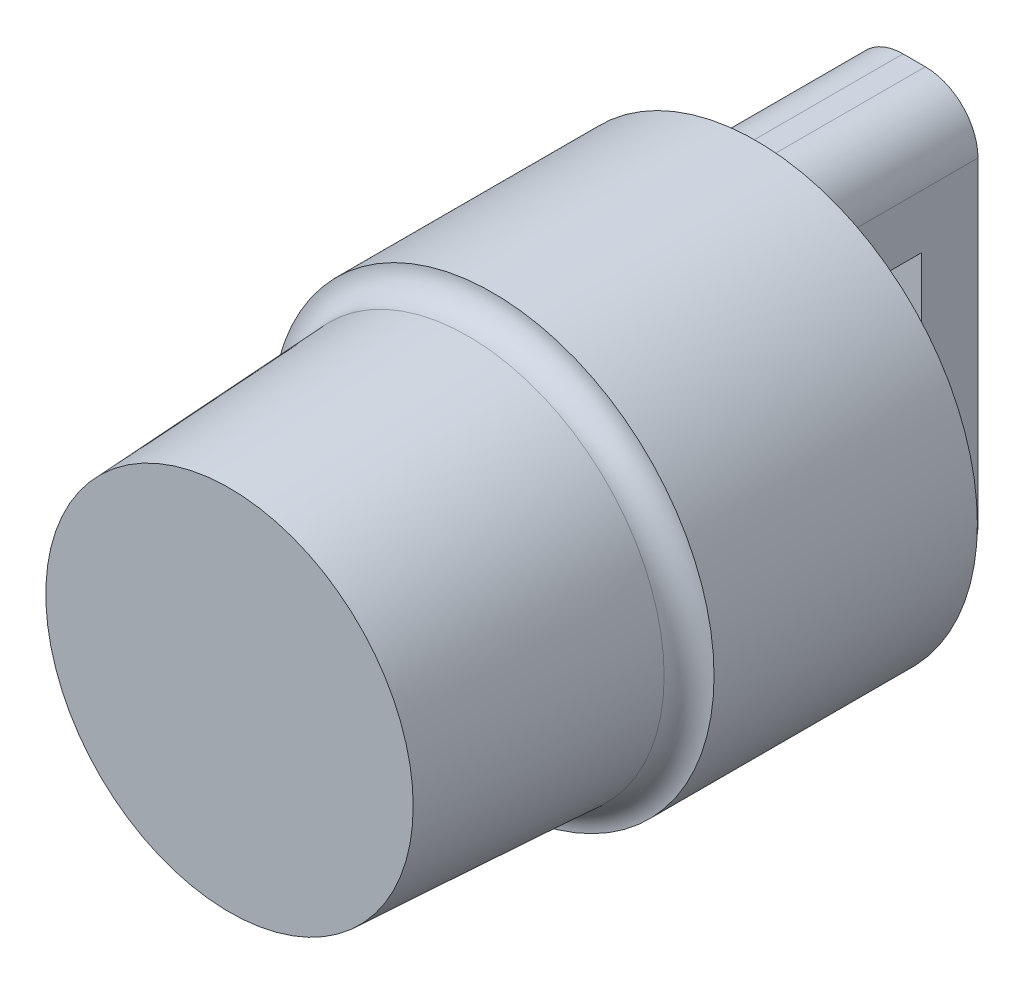
from build123d import *

# Parameters (mm, degrees)
SKETCH_1_R          = 8.4
EXTRUDE_1_DEPTH     = 10
SKETCH_2_R          = 7.5
EXTRUDE_2_DEPTH     = 10
EXTRUDE_2_TAPER     = 3.0000000000000027
SKETCH_3_W          = 4.846227442126801
SKETCH_3_H          = 16.08583474921887
EXTRUDE_3_DEPTH     = 6
FILLET_1_R          = 2
FILLET_2_R          = 1
CUT_EXTRUDE_1_DEPTH = 25.24252038183517


with BuildPart() as part:
    # Эскиз1 → Бобышка-Вытянуть1 (new body)
    with BuildSketch(Plane.XY):
        Circle(SKETCH_1_R)
    extrude(amount=EXTRUDE_1_DEPTH)

    # Эскиз2 → Бобышка-Вытянуть2 (add)
    with BuildSketch(Plane.XY.offset(10)):
        Circle(SKETCH_2_R)
    extrude(amount=EXTRUDE_2_DEPTH, taper=EXTRUDE_2_TAPER)

    # Эскиз3 → Бобышка-Вытянуть3 (add)
    with BuildSketch(Plane(origin=(0, 0, 0), x_dir=(-1, 0, 0), z_dir=(0, 0, -1))):
        Rectangle(SKETCH_3_W, SKETCH_3_H)
    extrude(amount=EXTRUDE_3_DEPTH)

    # Скругление1
    fillet_1_edges = [part.edges().sort_by_distance(p)[0] for p in [
        (-2.4231137210634004, -8.042917374609434, -3),
        (-2.4231137210634004, 8.042917374609434, -3),
        (2.4231137210634004, 8.042917374609434, -3),
        (2.4231137210634004, -8.042917374609434, -3),
    ]]
    fillet(fillet_1_edges, radius=FILLET_1_R)

    # Скругление2
    # the kernel refuses this fillet: 1 mm, written as the material it adds along each edge
    with BuildSketch(Plane(origin=(-6.3e-16, 6.7e-16, 10), x_dir=(1, -3.3e-16, 0), z_dir=(3.3e-16, 1, 0))) as fillet_2_piece_1:
        with BuildLine():
            CenterArc((8.449027591022826, -0.9987974245654119), FILLET_2_R, 92.81020062838743, 84.18979937161257)
            Line((7.450398056268253, -0.9464614683224681), (7.430425465573162, -0.9454147491976084))
            Line((7.430425465573162, -0.9454147491976084), (7.48002740930491, 0.00104671912485976))
            Line((7.48002740930491, 0.00104671912485976), (7.500000000000001, 0.01999999999999957))
            ThreePointArc((7.500000000000001, 0.01999999999999957), (7.950000000000001, 0.01999999999999957), (8.399019448179544, 0.01997594849130735))
            Line((8.399019448179544, 0.01997594849130735), (8.4, 0))
        make_face()
    revolve(axis=Axis((-6.3e-16, 6.7e-16, 10), (0, 0, -1)))

    # Эскиз4 → Вырез-Вытянуть1 (cut, through all)
    with BuildSketch(Plane.ZY.offset(2.4231137210634004)):
        Polygon((-3.85980947138648, 3.9999999999999982), (-1.85980947138648, 3.9999999999999982), (-1.8598094713864777, -4.000000000000001), (-3.85980947138648, -4.000000000000002), align=None)
    extrude(amount=-CUT_EXTRUDE_1_DEPTH, mode=Mode.SUBTRACT)


solid = part.part
